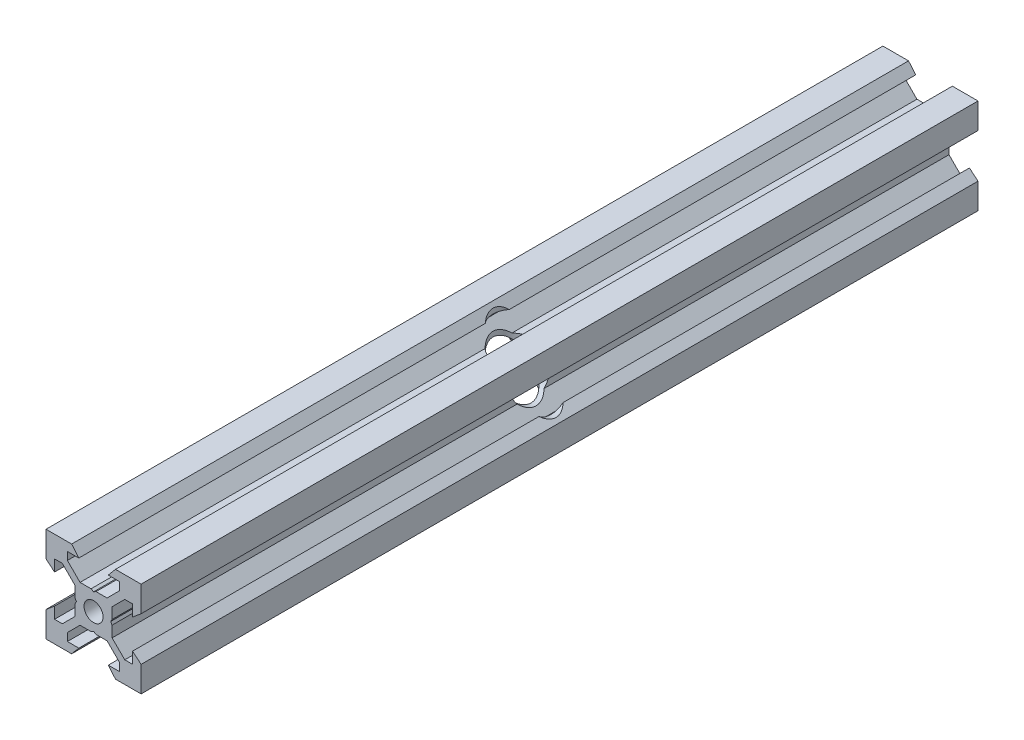
from build123d import *

# Parameters (mm, degrees)
SKETCH1_R               = 2
BOSS_EXTRUDE1_DEPTH     = 176
CUT_EXTRUDE1_DEPTH      = 177.567267635
CUT_EXTRUDE1_DEPTH_BACK = 177.567267635
SKETCH4_R               = 4
CUT_EXTRUDE2_DEPTH      = 177.567267734
CUT_EXTRUDE2_DEPTH_BACK = 177.567267734
SKETCH5_R               = 4


with BuildPart() as part:
    # Sketch1 → Boss-Extrude1 (new body)
    with BuildSketch(Plane.XY):
        Polygon((10, 4.610379336), (10, 10), (4.610379336, 10), (3.1, 8.2), (5.5, 8.2), (5.5, 6.560660172), (2.839339828, 3.9), (0.519615242, 3.9), (0, 3.6), (-0.519615242, 3.9), (-2.839339828, 3.9), (-5.5, 6.560660172), (-5.5, 8.2), (-3.1, 8.2), (-4.610379336, 10), (-10, 10), (-10, 4.610379336), (-8.2, 3.1), (-8.2, 5.5), (-6.560660172, 5.5), (-3.9, 2.839339828), (-3.9, 0.519615242), (-3.6, 0), (-3.9, -0.519615242), (-3.9, -2.839339828), (-6.560660172, -5.5), (-8.2, -5.5), (-8.2, -3.1), (-10, -4.610379336), (-10, -10), (-4.610379336, -10), (-3.1, -8.2), (-5.5, -8.2), (-5.5, -6.560660172), (-2.839339828, -3.9), (-0.519615242, -3.9), (0, -3.6), (0.519615242, -3.9), (2.839339828, -3.9), (5.5, -6.560660172), (5.5, -8.2), (3.1, -8.2), (4.610379336, -10), (10, -10), (10, -4.610379336), (8.2, -3.1), (8.2, -5.5), (6.560660172, -5.5), (3.9, -2.839339828), (3.9, -0.519615242), (3.6, 0), (3.9, 0.519615242), (3.9, 2.839339828), (6.560660172, 5.5), (8.2, 5.5), (8.2, 3.1), align=None)
        Circle(SKETCH1_R, mode=Mode.SUBTRACT)
    extrude(amount=BOSS_EXTRUDE1_DEPTH)

    # Sketch4 → Cut-Extrude1 (cut, two sides: drawn at the far end of the back side and taken through both)
    with BuildSketch(Plane(origin=(0, 0, 0), x_dir=(0, 0, -1), z_dir=(1, 0, 0)).offset(-CUT_EXTRUDE1_DEPTH_BACK)):
        with Locations((-88, 0)):
            Circle(SKETCH4_R)
    extrude(amount=CUT_EXTRUDE1_DEPTH + CUT_EXTRUDE1_DEPTH_BACK, mode=Mode.SUBTRACT)

    # Sketch5 → Cut-Extrude2 (cut, two sides: drawn at the far end of the back side and taken through both)
    with BuildSketch(Plane(origin=(0, 0, 0), x_dir=(1, 0, 0), z_dir=(0, 1, 0)).offset(-CUT_EXTRUDE2_DEPTH_BACK)):
        with Locations((0, -88)):
            Circle(SKETCH5_R)
    extrude(amount=CUT_EXTRUDE2_DEPTH + CUT_EXTRUDE2_DEPTH_BACK, mode=Mode.SUBTRACT)


solid = part.part
